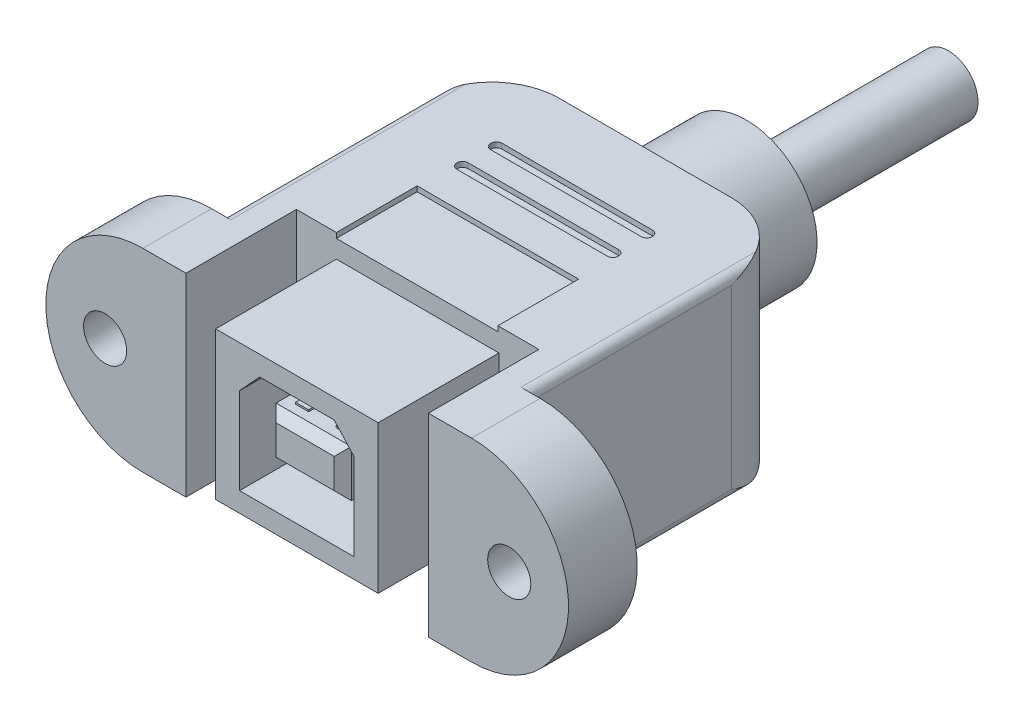
from build123d import *

# Parameters (mm, degrees)
SKETCH1_R           = 1.6
BOSS_EXTRUDE1_DEPTH = 5.1
BOSS_EXTRUDE2_DEPTH = 20
SKETCH3_R           = 5.25
BOSS_EXTRUDE3_DEPTH = 7.5
SKETCH4_R           = 2.2
BOSS_EXTRUDE4_DEPTH = 15
SKETCH11_W          = 18
SKETCH11_H          = 8.2
CUT_EXTRUDE3_DEPTH  = 49.887319419
SKETCH5_W           = 12.065
SKETCH5_H           = 10.9728
BOSS_EXTRUDE5_DEPTH = 0.762
SKETCH12_W          = 12.065
SKETCH12_H          = 10.9728
BOSS_EXTRUDE9_DEPTH = 8.2
CUT_EXTRUDE1_DEPTH  = 8.89
SKETCH7_W           = 5.588
SKETCH7_H           = 3.4798
BOSS_EXTRUDE6_DEPTH = 8.3058
CHAMFER1_SIZE       = 0.635
SKETCH8_W           = 0.967388598
SKETCH8_H           = 7.023469871
BOSS_EXTRUDE7_DEPTH = 0.127
SKETCH9_W           = 11.9888
SKETCH9_H           = 5.9944
CUT_EXTRUDE2_DEPTH  = 0.381
FILLET1_R           = 5


with BuildPart() as part:
    # Sketch1 → Boss-Extrude1 (new body)
    with BuildSketch(Plane.XY):
        with BuildLine():
            Line((-12.2, -7.2), (12.2, -7.2))
            ThreePointArc((12.2, -7.2), (19.4, 0), (12.2, 7.2))
            Line((12.2, 7.2), (-12.2, 7.2))
            ThreePointArc((-12.2, 7.2), (-19.4, 0), (-12.2, -7.2))
        make_face()
        with Locations((-15, 0)):
            Circle(SKETCH1_R, mode=Mode.SUBTRACT)
        with Locations((15, 0)):
            Circle(SKETCH1_R, mode=Mode.SUBTRACT)
    extrude(amount=BOSS_EXTRUDE1_DEPTH)

    # Sketch2 → Boss-Extrude2 (add)
    with BuildSketch(Plane(origin=(0, 0, 0), x_dir=(-1, 0, 0), z_dir=(0, 0, -1))):
        with BuildLine():
            Line((-10.765, 7.2), (10.765, 7.2))
            ThreePointArc((10.765, 7.2), (11.214012806, 7.014012806), (11.4, 6.565))
            Line((11.4, 6.565), (11.4, -6.565))
            ThreePointArc((11.4, -6.565), (11.214012806, -7.014012806), (10.765, -7.2))
            Line((10.765, -7.2), (-10.765, -7.2))
            ThreePointArc((-10.765, -7.2), (-11.214012806, -7.014012806), (-11.4, -6.565))
            Line((-11.4, -6.565), (-11.4, 6.565))
            ThreePointArc((-11.4, 6.565), (-11.214012806, 7.014012806), (-10.765, 7.2))
        make_face()
    extrude(amount=BOSS_EXTRUDE2_DEPTH)

    # Sketch3 → Boss-Extrude3 (add)
    with BuildSketch(Plane(origin=(0, 0, -20), x_dir=(-1, 0, 0), z_dir=(0, 0, -1))):
        Circle(SKETCH3_R)
    extrude(amount=BOSS_EXTRUDE3_DEPTH)

    # Sketch4 → Boss-Extrude4 (add)
    with BuildSketch(Plane(origin=(0, 0, -27.5), x_dir=(-1, 0, 0), z_dir=(0, 0, -1))):
        Circle(SKETCH4_R)
    extrude(amount=BOSS_EXTRUDE4_DEPTH)

    # Sketch11 → Cut-Extrude3 (cut, through all)
    with BuildSketch(Plane(origin=(0, 7.2, 0), x_dir=(1, 0, 0), z_dir=(0, 1, 0))):
        with Locations((0, -1)):
            Rectangle(SKETCH11_W, SKETCH11_H)
    extrude(amount=-CUT_EXTRUDE3_DEPTH, mode=Mode.SUBTRACT)



with BuildPart() as body_2:
    # Sketch5 → Boss-Extrude5 (new body)
    with BuildSketch(Plane.XY.offset(5.1)):
        Rectangle(SKETCH5_W, SKETCH5_H)
    extrude(amount=BOSS_EXTRUDE5_DEPTH)


with BuildPart() as part_1:
    add(part.part)

    add(body_2.part)  # Boss-Extrude9 merges body 2
    # Sketch12 → Boss-Extrude9 (add)
    with BuildSketch(Plane.XY.offset(-3.1)):
        Rectangle(SKETCH12_W, SKETCH12_H)
    extrude(amount=BOSS_EXTRUDE9_DEPTH)

    # Sketch6 → Cut-Extrude1 (cut)
    with BuildSketch(Plane.XY.offset(5.862)):
        Polygon((-4.2545, 2.4003), (-4.2545, -4.0259), (4.2545, -4.0259), (4.2545, 2.4003), (2.7686, 4.0259), (-2.7686, 4.0259), align=None)
    extrude(amount=-CUT_EXTRUDE1_DEPTH, mode=Mode.SUBTRACT)

    # Sketch7 → Boss-Extrude6 (add)
    with BuildSketch(Plane.XY.offset(-3.028)):
        with Locations((0.0254, 0)):
            Rectangle(SKETCH7_W, SKETCH7_H)
    extrude(amount=BOSS_EXTRUDE6_DEPTH)

    # Chamfer1
    chamfer1_edges = [part_1.edges().sort_by_distance(p)[0] for p in [
        (0.0254, 1.7399, 5.2778),
        (-2.7686, 0, 5.2778),
        (0.0254, -1.7399, 5.2778),
        (2.8194, 0, 5.2778),
    ]]
    chamfer(chamfer1_edges, length=CHAMFER1_SIZE)

    # Sketch8 → Boss-Extrude7 (add)
    with BuildSketch(Plane(origin=(0, 1.7399, 0), x_dir=(1, 0, 0), z_dir=(0, 1, 0))):
        with Locations((-1.479557486, -0.483734936)):
            Rectangle(SKETCH8_W, SKETCH8_H)
        with Locations((1.530357486, -0.483734936)):
            Rectangle(SKETCH8_W, SKETCH8_H)
    boss_extrude7 = extrude(amount=BOSS_EXTRUDE7_DEPTH)

    # Mirror1: Boss-Extrude7 across plane
    add(boss_extrude7.mirror(Plane(origin=(0, 0, 0), x_dir=(0, 0, 1), z_dir=(0, -1, 0))))

    # Sketch9 → Cut-Extrude2 (cut)
    with BuildSketch(Plane(origin=(0, 7.2, 0), x_dir=(1, 0, 0), z_dir=(0, 1, 0))):
        with Locations((-0.0381, 6.0972)):
            Rectangle(SKETCH9_W, SKETCH9_H)
        with BuildLine():
            Line((-5.6261, 12.4726), (5.5499, 12.4726))
            ThreePointArc((5.5499, 12.4726), (5.837268196, 12.353568196), (5.9563, 12.0662))
            Line((5.9563, 12.0662), (5.9563, 12.0408))
            ThreePointArc((5.9563, 12.0408), (5.837268196, 11.753431804), (5.5499, 11.6344))
            Line((5.5499, 11.6344), (-5.6261, 11.6344))
            ThreePointArc((-5.6261, 11.6344), (-5.913468196, 11.753431804), (-6.0325, 12.0408))
            Line((-6.0325, 12.0408), (-6.0325, 12.0662))
            ThreePointArc((-6.0325, 12.0662), (-5.913468196, 12.353568196), (-5.6261, 12.4726))
        make_face()
        with BuildLine():
            Line((-5.6261, 14.9872), (5.5499, 14.9872))
            ThreePointArc((5.5499, 14.9872), (5.837268196, 14.868168196), (5.9563, 14.5808))
            Line((5.9563, 14.5808), (5.9563, 14.5554))
            ThreePointArc((5.9563, 14.5554), (5.837268196, 14.268031804), (5.5499, 14.149))
            Line((5.5499, 14.149), (-5.6261, 14.149))
            ThreePointArc((-5.6261, 14.149), (-5.913468196, 14.268031804), (-6.0325, 14.5554))
            Line((-6.0325, 14.5554), (-6.0325, 14.5808))
            ThreePointArc((-6.0325, 14.5808), (-5.913468196, 14.868168196), (-5.6261, 14.9872))
        make_face()
    cut_extrude2 = extrude(amount=-CUT_EXTRUDE2_DEPTH, mode=Mode.SUBTRACT)

    # Mirror3: Cut-Extrude2 across plane
    add(cut_extrude2.mirror(Plane.ZX), mode=Mode.SUBTRACT)

    # Fillet1
    # the kernel refuses this fillet: 5 mm, written as the material it takes off along each edge
    with BuildSketch(Plane(origin=(11.4, -19.065, -20), x_dir=(-1, 0, 0), z_dir=(0, 1, 0)), Plane(origin=(-11.4, 19.065, -20), x_dir=(1, 0, 0), z_dir=(0, -1, 0))) as fillet1_piece_1:
        with BuildLine():
            CenterArc((FILLET1_R, FILLET1_R), FILLET1_R, 180, 90)
            Line((0, FILLET1_R), (0, 0))
            Line((0, 0), (FILLET1_R, 0))
        make_face()
    extrude(amount=38.13, mode=Mode.SUBTRACT)


solid = part_1.part
